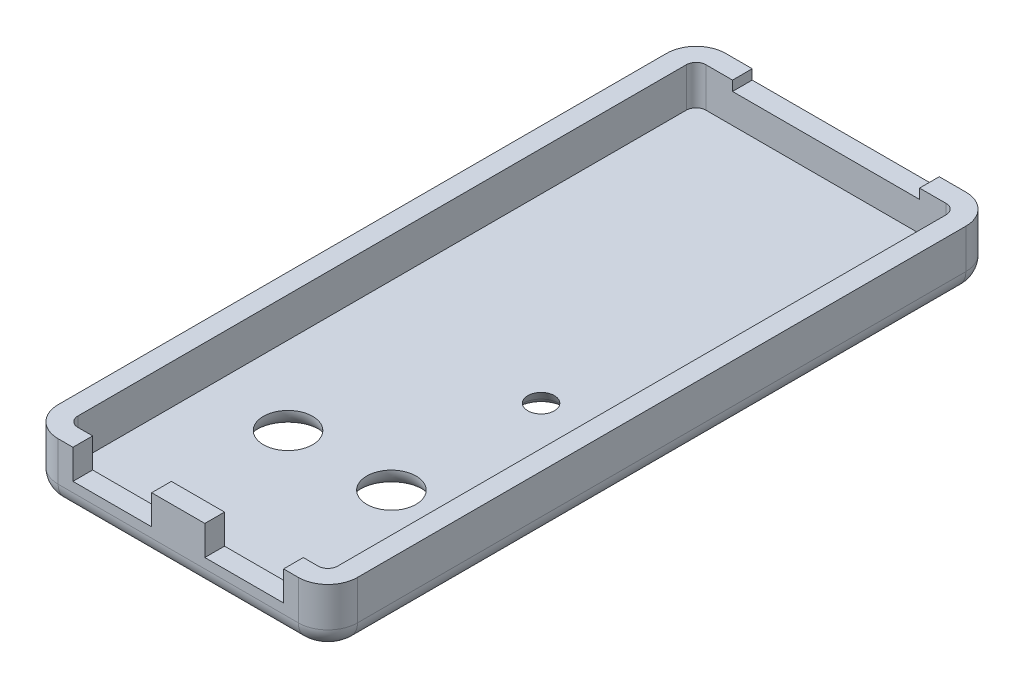
from build123d import *

# Parameters (mm, degrees)
BOSS_EXTRUDE1_DEPTH = 2
BOSS_EXTRUDE2_DEPTH = 4
SKETCH3_W           = 8
SKETCH3_H           = 3
CUT_EXTRUDE1_DEPTH  = 10
SKETCH4_W           = 19
SKETCH4_H           = 1
CUT_EXTRUDE2_DEPTH  = 10
SKETCH5_R           = 2.5
CUT_EXTRUDE3_DEPTH  = 2
CUT_EXTRUDE3_DRAFT  = -30
SKETCH6_R           = 2.5
CUT_EXTRUDE4_DEPTH  = 2
FILLET1_R           = 2


with BuildPart() as part:
    # Sketch1 → Boss-Extrude1 (new body)
    with BuildSketch(Plane(origin=(0, 0, 0), x_dir=(1, 0, 0), z_dir=(0, 1, 0))):
        with BuildLine():
            Line((-12.2, 33.9), (12.2, 33.9))
            ThreePointArc((12.2, 33.9), (14.321320344, 33.021320344), (15.2, 30.9))
            Line((15.2, 30.9), (15.2, -30.9))
            ThreePointArc((15.2, -30.9), (14.321320344, -33.021320344), (12.2, -33.9))
            Line((12.2, -33.9), (-12.2, -33.9))
            ThreePointArc((-12.2, -33.9), (-14.321320344, -33.021320344), (-15.2, -30.9))
            Line((-15.2, -30.9), (-15.2, 30.9))
            ThreePointArc((-15.2, 30.9), (-14.321320344, 33.021320344), (-12.2, 33.9))
        make_face()
    extrude(amount=BOSS_EXTRUDE1_DEPTH)


with BuildPart() as body_2:
    # Sketch2 → Boss-Extrude2 (new body)
    with BuildSketch(Plane(origin=(0, 2, 0), x_dir=(1, 0, 0), z_dir=(0, 1, 0))):
        with BuildLine():
            Line((-12.2, -33.9), (12.2, -33.9))
            ThreePointArc((12.2, -33.9), (14.321320344, -33.021320344), (15.2, -30.9))
            Line((15.2, -30.9), (15.2, 30.9))
            ThreePointArc((15.2, 30.9), (14.321320344, 33.021320344), (12.2, 33.9))
            Line((12.2, 33.9), (-12.2, 33.9))
            ThreePointArc((-12.2, 33.9), (-14.321320344, 33.021320344), (-15.2, 30.9))
            Line((-15.2, 30.9), (-15.2, -30.9))
            ThreePointArc((-15.2, -30.9), (-14.321320344, -33.021320344), (-12.2, -33.9))
        make_face()
        with BuildLine():
            Line((-12.2, -31.9), (12.2, -31.9))
            ThreePointArc((12.2, -31.9), (12.907106781, -31.607106781), (13.2, -30.9))
            Line((13.2, -30.9), (13.2, 30.9))
            ThreePointArc((13.2, 30.9), (12.907106781, 31.607106781), (12.2, 31.9))
            Line((12.2, 31.9), (-12.2, 31.9))
            ThreePointArc((-12.2, 31.9), (-12.907106781, 31.607106781), (-13.2, 30.9))
            Line((-13.2, 30.9), (-13.2, -30.9))
            ThreePointArc((-13.2, -30.9), (-12.907106781, -31.607106781), (-12.2, -31.9))
        make_face(mode=Mode.SUBTRACT)
    extrude(amount=BOSS_EXTRUDE2_DEPTH)

    # Sketch3 → Cut-Extrude1 (cut)
    with BuildSketch(Plane.XY.offset(33.9)):
        with Locations((6.7, 4.5)):
            Rectangle(SKETCH3_W, SKETCH3_H)
        with Locations((-6.7, 4.5)):
            Rectangle(SKETCH3_W, SKETCH3_H)
    extrude(amount=-CUT_EXTRUDE1_DEPTH, mode=Mode.SUBTRACT)

    # Sketch4 → Cut-Extrude2 (cut)
    with BuildSketch(Plane(origin=(0, 0, -33.9), x_dir=(-1, 0, 0), z_dir=(0, 0, -1))):
        with Locations((0, 5.5)):
            Rectangle(SKETCH4_W, SKETCH4_H)
    extrude(amount=-CUT_EXTRUDE2_DEPTH, mode=Mode.SUBTRACT)


with BuildPart() as cut_extrude3_tool:
    # Sketch5 → Cut-Extrude3 (with draft: the straight prism first)
    with BuildSketch(Plane.XZ):
        with Locations((5.2, 2.244994432)):
            Circle(SKETCH5_R)
    extrude(amount=-CUT_EXTRUDE3_DEPTH)
    # Cut-Extrude3: the draft: its side faces are tilted about the plane it starts from
    cut_extrude3_sides = [cut_extrude3_tool.faces().sort_by_distance(p)[0] for p in [
        (2.7, 1, 2.244994432),
    ]]
    draft(cut_extrude3_sides, Plane.XZ, CUT_EXTRUDE3_DRAFT)


with BuildPart() as part_1:
    add(part.part)

    # Cut-Extrude3: cut by cut_extrude3_tool
    add(cut_extrude3_tool.part, mode=Mode.SUBTRACT)

    # Sketch6 → Cut-Extrude4 (cut)
    with BuildSketch(Plane.XZ):
        with Locations(Location((5.25, 17.5, 0), (0, 0, 270))):
            Circle(SKETCH6_R)
        with Locations(Location((-5.25, 17.5, 0), (0, 0, 270))):
            Circle(SKETCH6_R)
    extrude(amount=-CUT_EXTRUDE4_DEPTH, mode=Mode.SUBTRACT)

    # Fillet1
    fillet1_edges = [part_1.edges().sort_by_distance(p)[0] for p in [
        (0, 0, 33.9),
        (14.321320344, 0, 33.021320344),
        (15.2, 0, 0),
        (14.321320344, 0, -33.021320344),
        (0, 0, -33.9),
        (-14.321320344, 0, -33.021320344),
        (-15.2, 0, 0),
        (-14.321320344, 0, 33.021320344),
        (2.7, 0, 2.244994432),
        (-5.25, 0, 20),
        (5.25, 0, 20),
    ]]
    fillet(fillet1_edges, radius=FILLET1_R - 0.0001)  # a hair under: the kernel refuses the full size


solid = Compound([body_2.part, part_1.part])
